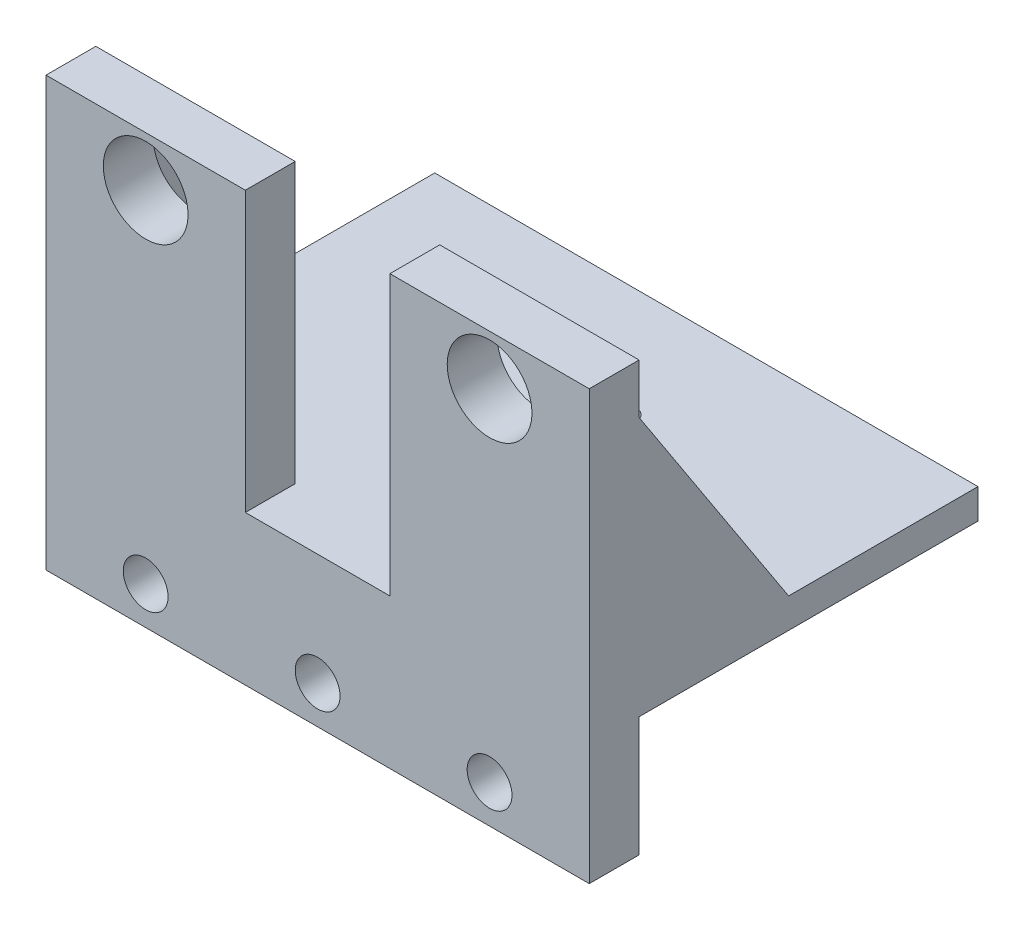
from build123d import *

# Parameters (mm, degrees)
SKETCH1_W                 = 54.5
SKETCH1_H                 = 39
BOSS_EXTRUDE1_DEPTH       = 3
SKETCH10_R                = 7
CUT_EXTRUDE1_DEPTH        = 5
M2_CLEARANCE_HOLE1_D      = 2.4
M2_CLEARANCE_HOLE1_DEPTH  = 17
M2_CLEARANCE_HOLE1_TIP    = 0.721032743
SKETCH12_W                = 20
SKETCH12_H                = 5
BOSS_EXTRUDE2_DEPTH       = 28
SKETCH13_R                = 4.25
CUT_EXTRUDE2_DEPTH        = 5
SKETCH16_W                = 54.5
SKETCH16_H                = 5
BOSS_EXTRUDE4_DEPTH       = 12
F_8_CLEARANCE_HOLE1_D     = 4.4958
F_8_CLEARANCE_HOLE1_DEPTH = 17
F_8_CLEARANCE_HOLE1_TIP   = 1.350674586
RIB2_REACH                = 70.517
SKETCH20_WALL_W           = 166.493784704
SKETCH20_WALL_H           = 5
RIB4_REACH                = 70.517
SKETCH21_WALL_W           = 166.493784704
SKETCH21_WALL_H           = 5


with BuildPart() as part:
    # Sketch1 → Boss-Extrude1 (new body)
    with BuildSketch(Plane(origin=(0, 0, 0), x_dir=(1, 0, 0), z_dir=(0, 1, 0))):
        with Locations((-13.399543841, 8.129312584)):
            Rectangle(SKETCH1_W, SKETCH1_H)
    extrude(amount=BOSS_EXTRUDE1_DEPTH)

    # Sketch10 → Cut-Extrude1 (cut)
    with BuildSketch(Plane(origin=(0, 3, 0), x_dir=(1, 0, 0), z_dir=(0, 1, 0))):
        with Locations((-10.149543841, 8.129312584)):
            Circle(SKETCH10_R)
    extrude(amount=-CUT_EXTRUDE1_DEPTH, mode=Mode.SUBTRACT)

    # M2 Clearance Hole1
    with Locations(Plane(origin=(-10.149543841, 3, -0.129312584), x_dir=(0, 0, 1), z_dir=(0, 1, 0))):
        with Locations((0, 0), (-8, 7.99475453), (-8, -7.99475453), (-16, 0)):
            Hole(M2_CLEARANCE_HOLE1_D / 2, depth=M2_CLEARANCE_HOLE1_DEPTH)
            with Locations((0, 0, -(M2_CLEARANCE_HOLE1_DEPTH + M2_CLEARANCE_HOLE1_TIP / 2))):  # 118° drill point
                Cone(0, M2_CLEARANCE_HOLE1_D / 2, M2_CLEARANCE_HOLE1_TIP, mode=Mode.SUBTRACT)

    # Sketch12 → Boss-Extrude2 (add)
    with BuildSketch(Plane(origin=(0, 3, 0), x_dir=(1, 0, 0), z_dir=(0, 1, 0))):
        with Locations((3.850456159, -8.870687416)):
            Rectangle(SKETCH12_W, SKETCH12_H)
        with Locations((-30.649543841, -8.870687416)):
            Rectangle(SKETCH12_W, SKETCH12_H)
    extrude(amount=BOSS_EXTRUDE2_DEPTH)

    # Sketch13 → Cut-Extrude2 (cut)
    with BuildSketch(Plane(origin=(0, 0, 6.370687416), x_dir=(-1, 0, 0), z_dir=(0, 0, -1))):
        with Locations((-3.850456159, 26)):
            Circle(SKETCH13_R)
        with Locations((30.649543841, 26)):
            Circle(SKETCH13_R)
    extrude(amount=-CUT_EXTRUDE2_DEPTH, mode=Mode.SUBTRACT)

    # Sketch16 → Boss-Extrude4 (add)
    with BuildSketch(Plane.XZ):
        with Locations((-13.399543841, 8.870687416)):
            Rectangle(SKETCH16_W, SKETCH16_H)
    extrude(amount=BOSS_EXTRUDE4_DEPTH)

    # #8 Clearance Hole1
    with Locations(Plane(origin=(-30.649543841, -8.2, 11.370687416), x_dir=(1, 0, 0), z_dir=(0, 0, 1))):
        with Locations((0, 0), (17.25, 0), (34.5, 0)):
            Hole(F_8_CLEARANCE_HOLE1_D / 2, depth=F_8_CLEARANCE_HOLE1_DEPTH)
            with Locations((0, 0, -(F_8_CLEARANCE_HOLE1_DEPTH + F_8_CLEARANCE_HOLE1_TIP / 2))):  # 118° drill point
                Cone(0, F_8_CLEARANCE_HOLE1_D / 2, F_8_CLEARANCE_HOLE1_TIP, mode=Mode.SUBTRACT)

    # Sketch20 wall → Rib2 (add, up to next)
    with BuildSketch(Plane(origin=(13.850456159, 14.5, -1.129312584), x_dir=(0, -0.837610596839, -0.546267780547), z_dir=(0, 0.546267780547, -0.837610596839)), mode=Mode.PRIVATE) as rib2_sk1:
        with Locations((0, 2.5)):
            Rectangle(SKETCH20_WALL_W, SKETCH20_WALL_H)
    rib2_tool1 = extrude(rib2_sk1.sketch, amount=-RIB2_REACH, mode=Mode.PRIVATE) - part.part
    add(rib2_tool1.solids().sort_by_distance((13.850456159, 14.5, -1.129312584))[0])

    # Sketch21 wall → Rib4 (add, up to next)
    with BuildSketch(Plane(origin=(-40.649543841, 14.5, -1.129312584), x_dir=(0, -0.837610596839, -0.546267780547), z_dir=(0, -0.546267780547, 0.837610596839)), mode=Mode.PRIVATE) as rib4_sk1:
        with Locations((0, 2.5)):
            Rectangle(SKETCH21_WALL_W, SKETCH21_WALL_H)
    rib4_tool1 = extrude(rib4_sk1.sketch, amount=RIB4_REACH, mode=Mode.PRIVATE) - part.part
    add(rib4_tool1.solids().sort_by_distance((-40.649543841, 14.5, -1.129312584))[0])


solid = part.part
